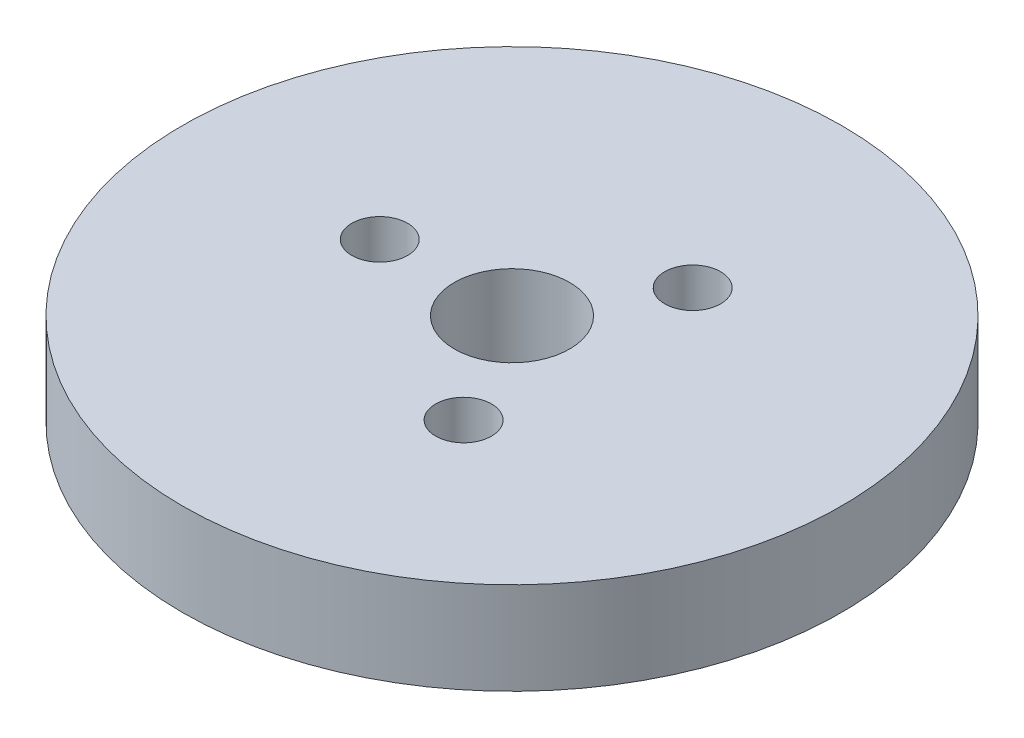
from build123d import *

# Parameters (mm, degrees)
SKETCH1_R           = 100
BOSS_EXTRUDE1_DEPTH = 28
SKETCH2_R           = 17.5
CUT_EXTRUDE1_DEPTH  = 145.166570328
SKETCH3_R           = 8.474663197
CUT_EXTRUDE2_DEPTH  = 27.725370323
CIRPATTERN1_COUNT   = 3


with BuildPart() as part:
    # Sketch1 → Boss-Extrude1 (new body)
    with BuildSketch(Plane(origin=(0, 0, 0), x_dir=(1, 0, 0), z_dir=(0, 1, 0))):
        Circle(SKETCH1_R)
    extrude(amount=BOSS_EXTRUDE1_DEPTH)

    # Sketch2 → Cut-Extrude1 (cut, through all)
    with BuildSketch(Plane(origin=(0, 0, 0), x_dir=(1, 0, 0), z_dir=(0, 1, 0))):
        Circle(SKETCH2_R)
    extrude(amount=CUT_EXTRUDE1_DEPTH, mode=Mode.SUBTRACT)

    # Sketch3 → Cut-Extrude2 (cut)
    with BuildSketch(Plane(origin=(0, 28, 0), x_dir=(1, 0, 0), z_dir=(0, 1, 0))):
        with Locations((-40.134746181, 0)):
            Circle(SKETCH3_R)
    cut_extrude2 = extrude(amount=-CUT_EXTRUDE2_DEPTH, mode=Mode.SUBTRACT)

    # CirPattern1: Cut-Extrude2 ×3 about axis
    cirpattern1_axis = Axis((0, 0, 0), (0, 1, 0))
    for i in range(1, CIRPATTERN1_COUNT):
        add(cut_extrude2.rotate(cirpattern1_axis, i * 360 / CIRPATTERN1_COUNT), mode=Mode.SUBTRACT)


solid = part.part
